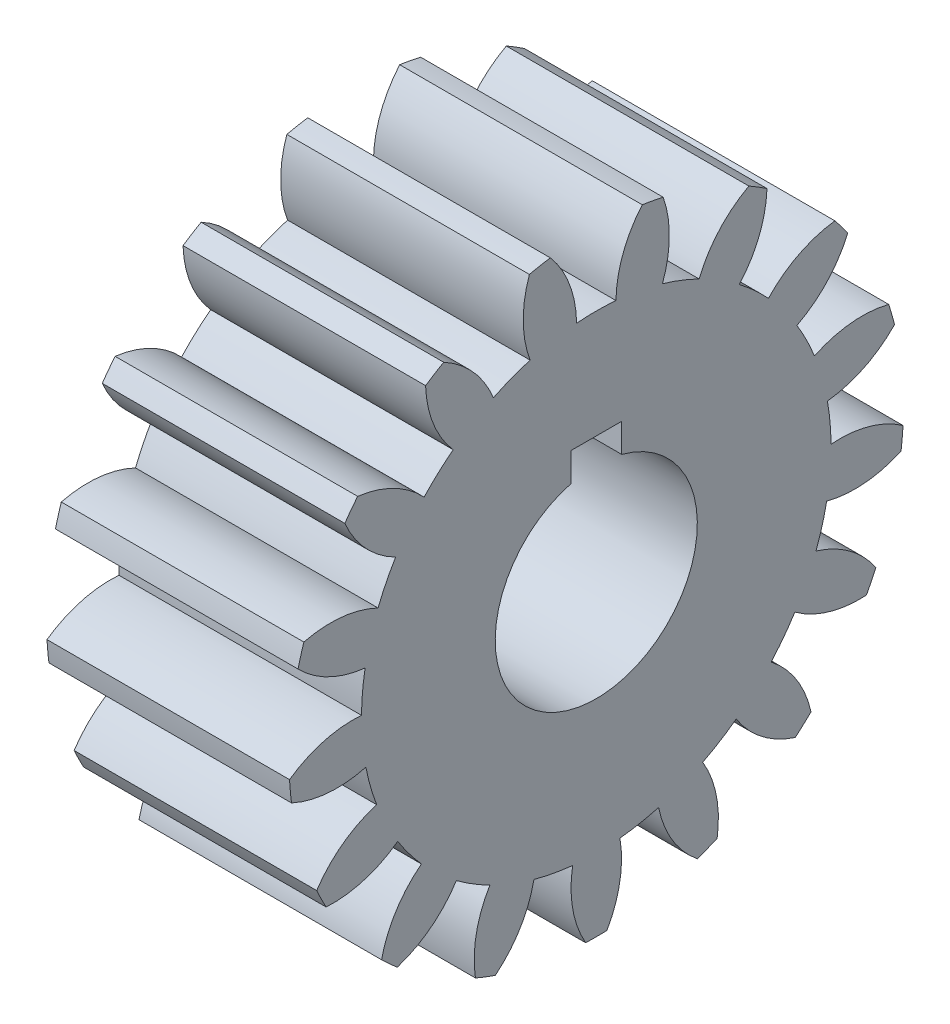
from build123d import *

# Parameters (mm, degrees)
SPUR_START             = -48.138720077
SPUR_GEAR_AI_OUTLINE_R = 3.96875
SPUR_GEAR_AI_DEPTH     = 9.525
SKETCH1_W              = 2
SKETCH1_H              = 2
CUT_EXTRUDE1_DEPTH     = 39.960158194


# Read off the part's stored shape, not the designer's step: spur gear_ai
with BuildPart() as part:
    # spur gear_ai outline → spur gear_ai (new body)
    with BuildSketch(Plane.YZ.offset(SPUR_START)):
        with BuildLine():
            ThreePointArc((17.012312953, 13.95653765), (17.238554936, 14.308167954), (17.452476746, 14.667426586))
            ThreePointArc((17.452476746, 14.667426586), (16.531280061, 15.83450279), (15.268831698, 16.619929001))
            ThreePointArc((15.268831698, 16.619929001), (15.578265643, 17.328851589), (15.827189257, 18.061216004))
            ThreePointArc((15.827189257, 18.061216004), (17.289288072, 17.791147015), (18.756314792, 18.033020543))
            ThreePointArc((18.756314792, 18.033020543), (18.840255641, 18.442634067), (18.909952602, 18.854910235))
            ThreePointArc((18.909952602, 18.854910235), (17.629365722, 19.61040176), (16.168439009, 19.886740939))
            ThreePointArc((16.168439009, 19.886740939), (16.200885193, 20.659571999), (16.168439009, 21.43240306))
            ThreePointArc((16.168439009, 21.43240306), (17.629365722, 21.708742239), (18.909952602, 22.464233764))
            ThreePointArc((18.909952602, 22.464233764), (18.840255641, 22.876509932), (18.756314792, 23.286123456))
            ThreePointArc((18.756314792, 23.286123456), (17.289288072, 23.527996984), (15.827189257, 23.257927995))
            ThreePointArc((15.827189257, 23.257927995), (15.578265643, 23.99029241), (15.268831698, 24.699214998))
            ThreePointArc((15.268831698, 24.699214998), (16.531280061, 25.484641209), (17.452476746, 26.651717413))
            ThreePointArc((17.452476746, 26.651717413), (17.238554936, 27.010976045), (17.012312953, 27.362606349))
            ThreePointArc((17.012312953, 27.362606349), (15.55697648, 27.05819552), (14.291170111, 26.278192676))
            ThreePointArc((14.291170111, 26.278192676), (13.794495212, 26.871180574), (13.249864274, 27.420450766))
            ThreePointArc((13.249864274, 27.420450766), (14.143333641, 28.608887845), (14.580727415, 30.029928621))
            ThreePointArc((14.580727415, 30.029928621), (14.251472081, 30.287649847), (13.913484198, 30.533807309))
            ThreePointArc((13.913484198, 30.533807309), (12.666389228, 29.724224493), (11.767829468, 28.5396315))
            ThreePointArc((11.767829468, 28.5396315), (11.090481981, 28.913156579), (10.384209477, 29.228592392))
            ThreePointArc((10.384209477, 29.228592392), (10.788031858, 30.659535328), (10.682550269, 32.142621244))
            ThreePointArc((10.682550269, 32.142621244), (10.282429168, 32.263998384), (9.878342522, 32.371438077))
            ThreePointArc((9.878342522, 32.371438077), (9.00791614, 31.166021918), (8.597958464, 29.736824624))
            ThreePointArc((8.597958464, 29.736824624), (7.831417921, 29.840440252), (7.058889866, 29.879440332))
            ThreePointArc((7.058889866, 29.879440332), (6.918526812, 31.359632351), (6.284415731, 32.704464437))
            ThreePointArc((6.284415731, 32.704464437), (5.867467436, 32.673104837), (5.451856166, 32.627316432))
            ThreePointArc((5.451856166, 32.627316432), (5.075654279, 31.188865063), (5.209665743, 29.708084482))
            ThreePointArc((5.209665743, 29.708084482), (4.457457692, 29.527796795), (3.72300828, 29.285093965))
            ThreePointArc((3.72300828, 29.285093965), (3.057416599, 30.614626934), (1.980316242, 31.639578163))
            ThreePointArc((1.980316242, 31.639578163), (1.60285193, 31.45971711), (1.231846643, 31.266884587))
            ThreePointArc((1.231846643, 31.266884587), (1.4006774, 29.789668835), (2.060559012, 28.45729259))
            ThreePointArc((2.060559012, 28.45729259), (1.424273318, 28.017450439), (0.827094013, 27.52582306))
            ThreePointArc((0.827094013, 27.52582306), (-0.273834451, 28.525136184), (-1.648455712, 29.091781215))
            ThreePointArc((-1.648455712, 29.091781215), (-1.935457393, 28.78770994), (-2.211750379, 28.473876399))
            ThreePointArc((-2.211750379, 28.473876399), (-1.520688507, 27.157402438), (-0.424057414, 26.153375324))
            ThreePointArc((-0.424057414, 26.153375324), (-0.858486842, 25.513381828), (-1.237743667, 24.839226903))
            ThreePointArc((-1.237743667, 24.839226903), (-2.625322424, 25.373357406), (-4.111814371, 25.405167687))
            ThreePointArc((-4.111814371, 25.405167687), (-4.269592255, 25.017952702), (-4.41385804, 24.625503102))
            ThreePointArc((-4.41385804, 24.625503102), (-3.293896789, 23.647568035), (-1.908622321, 23.107489476))
            ThreePointArc((-1.908622321, 23.107489476), (-2.082523381, 22.353779304), (-2.19263699, 21.58814519))
            ThreePointArc((-2.19263699, 21.58814519), (-3.67946584, 21.58495579), (-5.077069498, 21.077635166))
            ThreePointArc((-5.077069498, 21.077635166), (-5.084314807, 20.659572), (-5.077069498, 20.241508833))
            ThreePointArc((-5.077069498, 20.241508833), (-3.67946584, 19.734188209), (-2.19263699, 19.730998809))
            ThreePointArc((-2.19263699, 19.730998809), (-2.082523381, 18.965364695), (-1.908622321, 18.211654523))
            ThreePointArc((-1.908622321, 18.211654523), (-3.293896789, 17.671575965), (-4.41385804, 16.693640897))
            ThreePointArc((-4.41385804, 16.693640897), (-4.269592255, 16.301191297), (-4.111814371, 15.913976312))
            ThreePointArc((-4.111814371, 15.913976312), (-2.625322424, 15.945786593), (-1.237743667, 16.479917096))
            ThreePointArc((-1.237743667, 16.479917096), (-0.858486842, 15.805762171), (-0.424057414, 15.165768676))
            ThreePointArc((-0.424057414, 15.165768676), (-1.520688507, 14.161741561), (-2.211750379, 12.8452676))
            ThreePointArc((-2.211750379, 12.8452676), (-1.935457393, 12.531434059), (-1.648455712, 12.227362784))
            ThreePointArc((-1.648455712, 12.227362784), (-0.273834451, 12.794007815), (0.827094013, 13.793320939))
            ThreePointArc((0.827094013, 13.793320939), (1.424273319, 13.301693561), (2.060559012, 12.861851409))
            ThreePointArc((2.060559012, 12.861851409), (1.4006774, 11.529475164), (1.231846643, 10.052259412))
            ThreePointArc((1.231846643, 10.052259412), (1.60285193, 9.859426889), (1.980316242, 9.679565836))
            ThreePointArc((1.980316242, 9.679565836), (3.057416599, 10.704517066), (3.72300828, 12.034050035))
            ThreePointArc((3.72300828, 12.034050035), (4.457457692, 11.791347204), (5.209665743, 11.611059517))
            ThreePointArc((5.209665743, 11.611059517), (5.075654279, 10.130278936), (5.451856166, 8.691827567))
            ThreePointArc((5.451856166, 8.691827567), (5.867467436, 8.646039163), (6.284415731, 8.614679562))
            ThreePointArc((6.284415731, 8.614679562), (6.918526812, 9.959511648), (7.058889866, 11.439703667))
            ThreePointArc((7.058889866, 11.439703667), (7.831417921, 11.478703747), (8.597958464, 11.582319375))
            ThreePointArc((8.597958464, 11.582319375), (9.00791614, 10.153122081), (9.878342522, 8.947705923))
            ThreePointArc((9.878342522, 8.947705923), (10.282429168, 9.055145615), (10.682550269, 9.176522755))
            ThreePointArc((10.682550269, 9.176522755), (10.788031858, 10.659608671), (10.384209477, 12.090551607))
            ThreePointArc((10.384209477, 12.090551607), (11.090481981, 12.405987421), (11.767829468, 12.779512499))
            ThreePointArc((11.767829468, 12.779512499), (12.666389228, 11.594919506), (13.913484198, 10.78533669))
            ThreePointArc((13.913484198, 10.78533669), (14.251472081, 11.031494152), (14.580727415, 11.289215378))
            ThreePointArc((14.580727415, 11.289215378), (14.143333641, 12.710256154), (13.249864274, 13.898693234))
            ThreePointArc((13.249864274, 13.898693234), (13.794495212, 14.447963426), (14.291170111, 15.040951324))
            ThreePointArc((14.291170111, 15.040951324), (15.55697648, 14.260948479), (17.012312953, 13.95653765))
        make_face()
        with Locations((6.980685193, 20.659572)):
            Circle(SPUR_GEAR_AI_OUTLINE_R, mode=Mode.SUBTRACT)
    extrude(amount=SPUR_GEAR_AI_DEPTH)

    # Sketch1 → Cut-Extrude1 (cut, through all)
    with BuildSketch(Plane(origin=(-38.613720077, 0, 0), x_dir=(0, 0, -1), z_dir=(1, 0, 0))):
        with Locations((-20.659572, 10.949435193)):
            Rectangle(SKETCH1_W, SKETCH1_H)
    extrude(amount=-CUT_EXTRUDE1_DEPTH, mode=Mode.SUBTRACT)


solid = part.part
